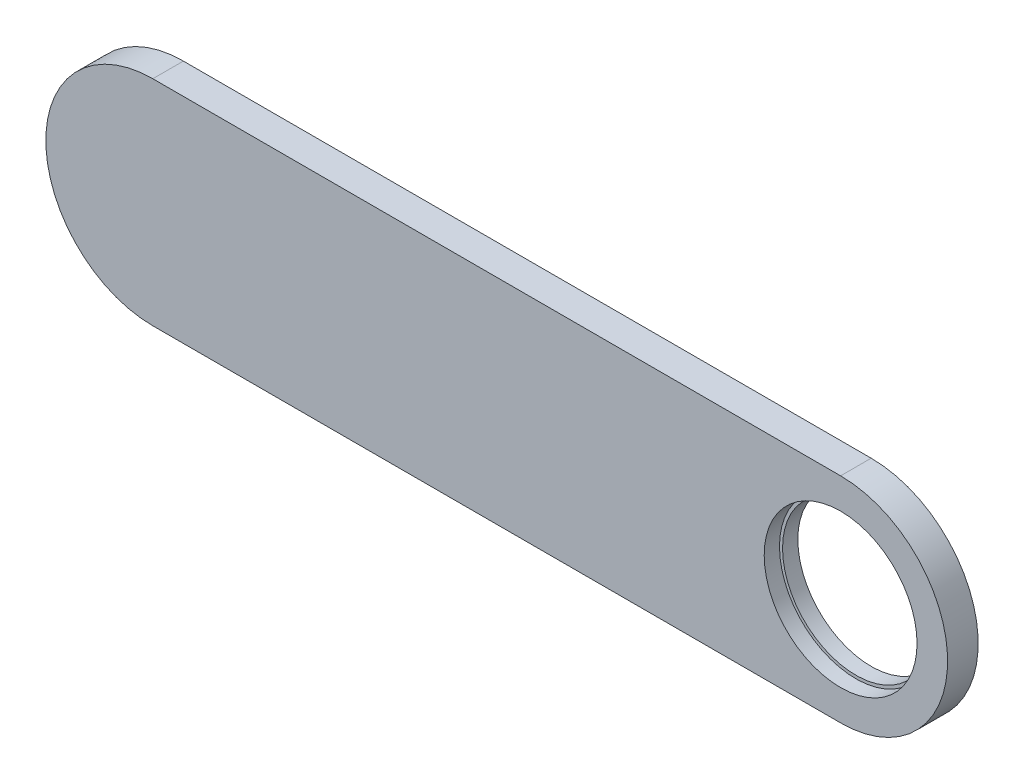
from build123d import *

# Parameters (mm, degrees)
ESQUISSE1_R        = 50
BOSS_EXTRU_1_DEPTH = 20
ESQUISSE2_R        = 50
ESQUISSE2_R_2      = 48
BOSS_EXTRU_2_DEPTH = 10


with BuildPart() as part:
    # Esquisse1 → Boss.-Extru.1 (new body)
    with BuildSketch(Plane.XY):
        with BuildLine():
            Line((0, -70), (-450, -70))
            ThreePointArc((-450, -70), (-520, 0), (-450, 70))
            Line((-450, 70), (0, 70))
            ThreePointArc((0, 70), (70, 0), (0, -70))
        make_face()
        Circle(ESQUISSE1_R, mode=Mode.SUBTRACT)
    extrude(amount=BOSS_EXTRU_1_DEPTH)

    # Esquisse2 → Boss.-Extru.2 (add)
    with BuildSketch(Plane(origin=(0, 0, 0), x_dir=(-1, 0, 0), z_dir=(0, 0, -1))):
        Circle(ESQUISSE2_R)
        Circle(ESQUISSE2_R_2, mode=Mode.SUBTRACT)
    extrude(amount=-BOSS_EXTRU_2_DEPTH)


solid = part.part
